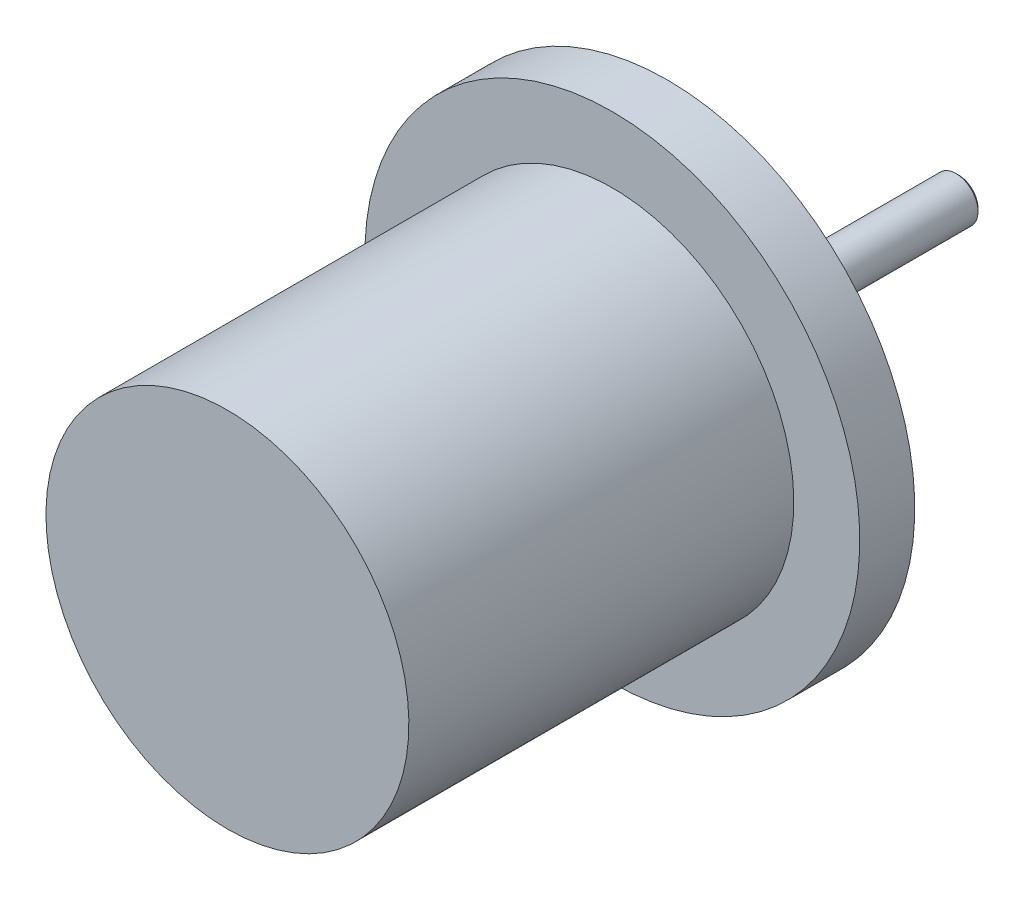
from build123d import *

# Parameters (mm, degrees)
CUT_EXTRUDE1_DEPTH = 2.5
CHAMFER1_SIZE      = 0.5
SKETCH7_R          = 3
CUT_EXTRUDE4_DEPTH = 3
SKETCH8_R          = 1.5
CUT_EXTRUDE5_DEPTH = 5
CHAMFER2_SIZE      = 0.5


with BuildPart() as part:
    # Sketch1 → Revolve1 (revolve)
    with BuildSketch(Plane(origin=(0, 0, 0), x_dir=(0, 0, -1), z_dir=(1, 0, 0))):
        Polygon((-67.783857366, 0), (65.216142634, 0), (65.216142634, 4), (31.216142634, 4), (31.216142634, 6), (15.216142634, 6), (15.216142634, 17.5), (12.216142634, 17.5), (12.216142634, 45), (2.216142634, 45), (2.216142634, 33), (-67.783857366, 33), align=None)
    revolve(axis=Axis((0, 0, 67.783857366), (0, 0, -1)))

    # Sketch2 → Cut-Extrude1 (cut)
    with BuildSketch(Plane(origin=(0, 6, 0), x_dir=(1, 0, 0), z_dir=(0, 1, 0))):
        with BuildLine():
            Line((-2.025, 20.732267436), (-2.025, 27.682267436))
            ThreePointArc((-2.025, 27.682267436), (0, 29.707267436), (2.025, 27.682267436))
            Line((2.025, 27.682267436), (2.025, 20.732267436))
            ThreePointArc((2.025, 20.732267436), (0, 18.707267436), (-2.025, 20.732267436))
        make_face()
    extrude(amount=-CUT_EXTRUDE1_DEPTH, mode=Mode.SUBTRACT)

    # Chamfer1
    chamfer1_edges = [part.edges().sort_by_distance(p)[0] for p in [
        (0, -6, -31.216142634),
    ]]
    chamfer(chamfer1_edges, length=CHAMFER1_SIZE)

    # Sketch7 → Cut-Extrude4 (cut)
    with BuildSketch(Plane(origin=(0, 0, -12.216142634), x_dir=(-1, 0, 0), z_dir=(0, 0, -1))):
        with Locations((35, 0)):
            Circle(SKETCH7_R)
        with Locations((24.748737342, 24.748737342)):
            Circle(SKETCH7_R)
        with Locations((24.748737342, -24.748737342)):
            Circle(SKETCH7_R)
        with Locations((0, 35)):
            Circle(SKETCH7_R)
        with Locations((0, -35)):
            Circle(SKETCH7_R)
        with Locations((-24.748737342, 24.748737342)):
            Circle(SKETCH7_R)
        with Locations((-24.748737342, -24.748737342)):
            Circle(SKETCH7_R)
        with Locations((-35, 0)):
            Circle(SKETCH7_R)
    extrude(amount=-CUT_EXTRUDE4_DEPTH, mode=Mode.SUBTRACT)

    # Sketch8 → Cut-Extrude5 (cut)
    with BuildSketch(Plane(origin=(0, 0, -65.216142634), x_dir=(-1, 0, 0), z_dir=(0, 0, -1))):
        Circle(SKETCH8_R)
    extrude(amount=-CUT_EXTRUDE5_DEPTH, mode=Mode.SUBTRACT)

    # Chamfer2
    chamfer2_edges = [part.edges().sort_by_distance(p)[0] for p in [
        (0, -4, -65.216142634),
    ]]
    chamfer(chamfer2_edges, length=CHAMFER2_SIZE)


solid = part.part
